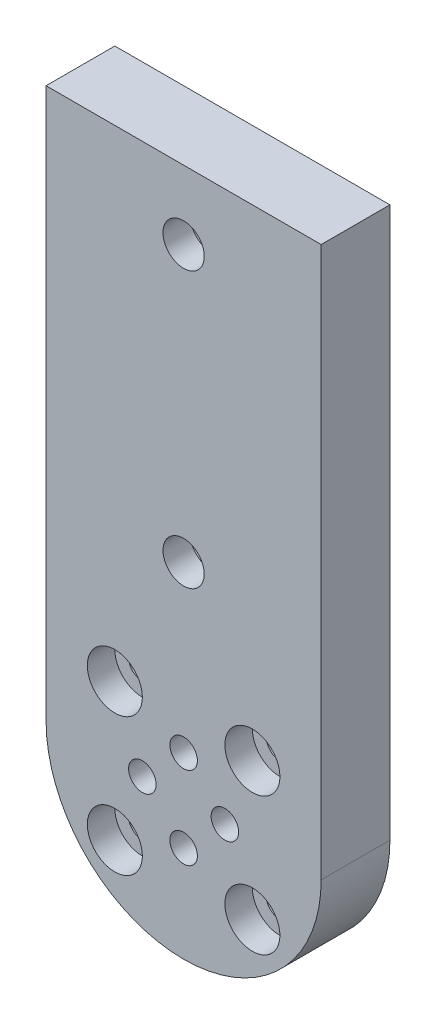
from build123d import *

# Parameters (mm, degrees)
SKETCH2_R           = 1.5
SKETCH2_R_2         = 1
BOSS_EXTRUDE1_DEPTH = 5
SKETCH5_R           = 2
SKETCH5_R_2         = 1
CUT_EXTRUDE2_DEPTH  = 2
SKETCH6_R           = 3.5
CUT_EXTRUDE3_DEPTH  = 3


with BuildPart() as part:
    # Sketch2 → Boss-Extrude1 (new body)
    with BuildSketch(Plane.XY):
        with BuildLine():
            Line((-10, 40), (-10, 0))
            ThreePointArc((-10, 0), (0, -10), (10, 0))
            Line((10, 0), (10, 40))
            Line((10, 40), (-10, 40))
        make_face()
        with Locations((0, 15)):
            Circle(SKETCH2_R, mode=Mode.SUBTRACT)
        with Locations((0, 35)):
            Circle(SKETCH2_R, mode=Mode.SUBTRACT)
        with Locations((5, 5)):
            Circle(SKETCH2_R_2, mode=Mode.SUBTRACT)
        with Locations((-5, -5)):
            Circle(SKETCH2_R_2, mode=Mode.SUBTRACT)
        with Locations((-5, 5)):
            Circle(SKETCH2_R_2, mode=Mode.SUBTRACT)
        with Locations((5, -5)):
            Circle(SKETCH2_R_2, mode=Mode.SUBTRACT)
    extrude(amount=BOSS_EXTRUDE1_DEPTH)

    # Sketch5 → Cut-Extrude2 (cut)
    with BuildSketch(Plane.XY.offset(5)):
        with Locations((-5, 5)):
            Circle(SKETCH5_R)
        with Locations((5, 5)):
            Circle(SKETCH5_R)
        with Locations((5, -5)):
            Circle(SKETCH5_R)
        with Locations((-5, -5)):
            Circle(SKETCH5_R)
        with Locations((0, 3)):
            Circle(SKETCH5_R_2)
        with Locations((-3, 0)):
            Circle(SKETCH5_R_2)
        with Locations((3, 0)):
            Circle(SKETCH5_R_2)
        with Locations((0, -3)):
            Circle(SKETCH5_R_2)
    extrude(amount=-CUT_EXTRUDE2_DEPTH, mode=Mode.SUBTRACT)

    # Sketch6 → Cut-Extrude3 (cut)
    with BuildSketch(Plane(origin=(0, 0, 0), x_dir=(-1, 0, 0), z_dir=(0, 0, -1))):
        with Locations((0, 35)):
            Circle(SKETCH6_R)
        with Locations((0, 15)):
            Circle(SKETCH6_R)
    extrude(amount=-CUT_EXTRUDE3_DEPTH, mode=Mode.SUBTRACT)


solid = part.part
